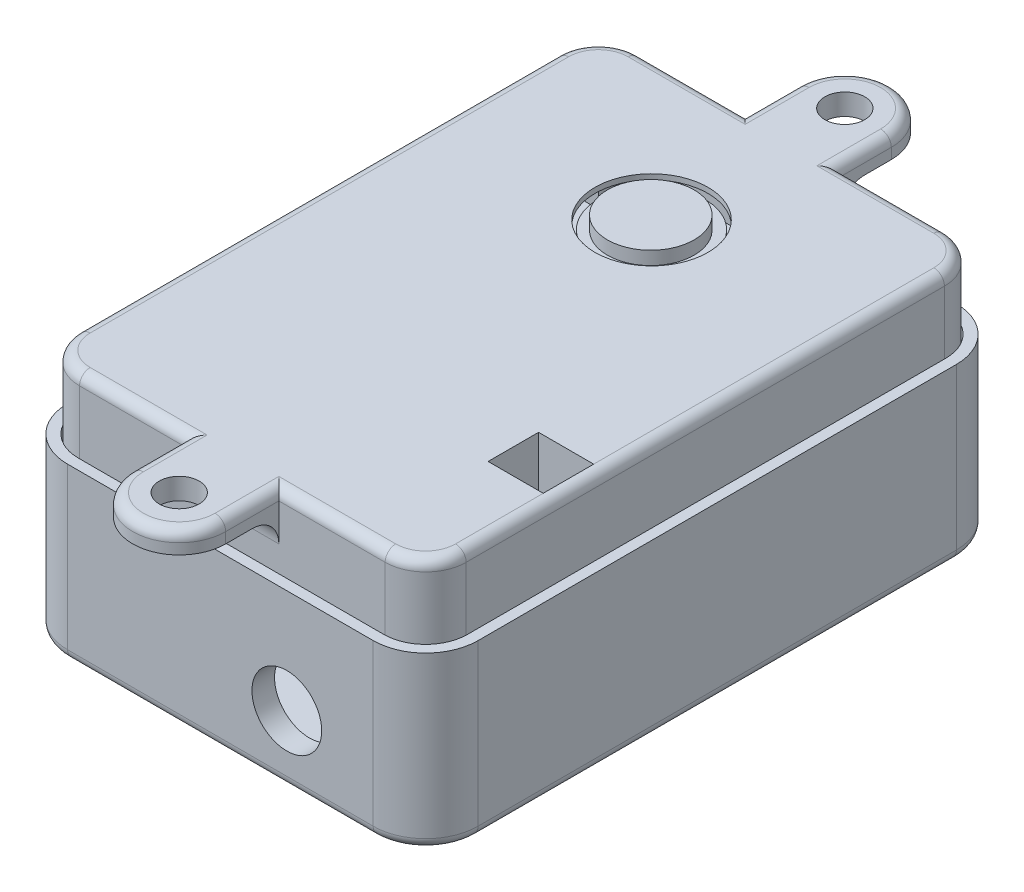
from build123d import *

# Parameters (mm, degrees)
BOSS_EXTRUDE1_DEPTH     = 1
SKETCH2_W               = 15
SKETCH2_H               = 15
BOSS_EXTRUDE2_DEPTH     = 2
SKETCH3_R               = 4
BOSS_EXTRUDE3_DEPTH     = 6.25
SKETCH5_W               = 3
SKETCH5_H               = 3
BOSS_EXTRUDE4_DEPTH     = 1
BOSS_EXTRUDE5_START     = 0.25
SKETCH6_R               = 4.25
BOSS_EXTRUDE5_DEPTH     = 0.4
BOSS_EXTRUDE7_DEPTH     = 9.5
BOSS_EXTRUDE9_DEPTH     = 8.4
SKETCH11_W              = 4.15
SKETCH11_H              = 3.8
CUT_EXTRUDE1_DEPTH      = 0.4
SKETCH12_W              = 18.75
SKETCH12_H              = 25.65
BOSS_EXTRUDE10_DEPTH    = 0.75
BOSS_EXTRUDE11_DEPTH    = 2.3
SKETCH14_W              = 2.5
SKETCH14_H              = 20.2
BOSS_EXTRUDE12_DEPTH    = 2.45
SKETCH16_W              = 0.6
SKETCH16_H              = 0.6
BOSS_EXTRUDE14_DEPTH    = 5.5
LPATTERN1_COUNT         = 8
LPATTERN1_PITCH         = 2.5
BOSS_EXTRUDE15_START    = 5
BOSS_EXTRUDE15_DEPTH    = 12.5
BOSS_EXTRUDE16_DEPTH    = 7.95
SKETCH19_W              = 3.5
SKETCH19_H              = 21.2
BOSS_EXTRUDE17_DEPTH    = 0.4
SKETCH20_R              = 2.625
CUT_EXTRUDE2_DEPTH      = 1.7
BOSS_EXTRUDE18_DEPTH    = 7.95
BOSS_EXTRUDE19_DEPTH    = 7.4
MIRROR1_COPY_1_SKETCH_W = 0.6
MIRROR1_COPY_1_SKETCH_H = 0.6
MIRROR1_COPY_1_DEPTH    = 5.5
MIRROR1_COPY_2_SKETCH_W = 0.6
MIRROR1_COPY_2_SKETCH_H = 0.6
MIRROR1_COPY_2_DEPTH    = 5.5
MIRROR1_COPY_3_SKETCH_W = 0.6
MIRROR1_COPY_3_SKETCH_H = 0.6
MIRROR1_COPY_3_DEPTH    = 5.5
MIRROR1_COPY_4_SKETCH_W = 0.6
MIRROR1_COPY_4_SKETCH_H = 0.6
MIRROR1_COPY_4_DEPTH    = 5.5
MIRROR1_COPY_5_SKETCH_W = 0.6
MIRROR1_COPY_5_SKETCH_H = 0.6
MIRROR1_COPY_5_DEPTH    = 5.5
MIRROR1_COPY_6_SKETCH_W = 0.6
MIRROR1_COPY_6_SKETCH_H = 0.6
MIRROR1_COPY_6_DEPTH    = 5.5
MIRROR1_COPY_7_SKETCH_W = 0.6
MIRROR1_COPY_7_SKETCH_H = 0.6
MIRROR1_COPY_7_DEPTH    = 5.5
SKETCH24_R              = 1.5
BOSS_EXTRUDE20_DEPTH    = 1.6
FILLET1_R               = 2
FILLET2_R               = 0.8
FILLET3_R               = 0.8
SKETCH25_R              = 3.262617174
BOSS_EXTRUDE21_DEPTH    = 1


with BuildPart() as part:
    # Sketch1 → Boss-Extrude1 (new body)
    with BuildSketch(Plane(origin=(0, 0, 0), x_dir=(1, 0, 0), z_dir=(0, 1, 0))):
        with BuildLine():
            Line((-11.5, 20), (11.5, 20))
            ThreePointArc((11.5, 20), (12.914213562, 19.414213562), (13.5, 18))
            Line((13.5, 18), (13.5, -18))
            ThreePointArc((13.5, -18), (12.914213562, -19.414213562), (11.5, -20))
            Line((11.5, -20), (-11.5, -20))
            ThreePointArc((-11.5, -20), (-12.914213562, -19.414213562), (-13.5, -18))
            Line((-13.5, -18), (-13.5, 18))
            ThreePointArc((-13.5, 18), (-12.914213562, 19.414213562), (-11.5, 20))
        make_face()
    extrude(amount=BOSS_EXTRUDE1_DEPTH)

    # Sketch2 → Boss-Extrude2 (add)
    with BuildSketch(Plane(origin=(0, 1, 0), x_dir=(1, 0, 0), z_dir=(0, 1, 0))):
        with Locations((0, 12.5)):
            Rectangle(SKETCH2_W, SKETCH2_H)
    extrude(amount=BOSS_EXTRUDE2_DEPTH)

    # Sketch3 → Boss-Extrude3 (add)
    with BuildSketch(Plane(origin=(0, 3, 0), x_dir=(1, 0, 0), z_dir=(0, 1, 0))):
        with Locations(Location((0, 10.5, 0), (0, 0, 270))):
            Circle(SKETCH3_R)
    extrude(amount=BOSS_EXTRUDE3_DEPTH)

    # Sketch5 → Boss-Extrude4 (add)
    with BuildSketch(Plane(origin=(0, 1, 0), x_dir=(1, 0, 0), z_dir=(0, 1, 0))):
        with Locations((11.5, -9.5)):
            Rectangle(SKETCH5_W, SKETCH5_H)
    extrude(amount=BOSS_EXTRUDE4_DEPTH)

    # Sketch12 → Boss-Extrude10 (add)
    with BuildSketch(Plane.XZ):
        with Locations((0, 7.175)):
            Rectangle(SKETCH12_W, SKETCH12_H)
    extrude(amount=BOSS_EXTRUDE10_DEPTH)

    # Sketch13 → Boss-Extrude11 (add)
    with BuildSketch(Plane.XZ.offset(0.75)):
        Polygon((2, 12.35), (-8, 12.35), (-8, -5.15), (8, -5.15), (8, 9.35), (2, 9.35), align=None)
    extrude(amount=BOSS_EXTRUDE11_DEPTH)

    # Sketch14 → Boss-Extrude12 (add)
    with BuildSketch(Plane.XZ):
        with Locations((11.5, -6.1)):
            Rectangle(SKETCH14_W, SKETCH14_H)
    boss_extrude12 = extrude(amount=BOSS_EXTRUDE12_DEPTH)

    # Sketch16 → Boss-Extrude14 (add)
    with BuildSketch(Plane.XZ.offset(2.45)):
        with Locations((11.5, 2.7)):
            Rectangle(SKETCH16_W, SKETCH16_H)
    boss_extrude14 = extrude(amount=BOSS_EXTRUDE14_DEPTH)

    # LPattern1: Boss-Extrude14 ×8
    with Locations(*[(0, 0, -i * LPATTERN1_PITCH) for i in range(1, LPATTERN1_COUNT)]):
        add(boss_extrude14)

    # Mirror1: Boss-Extrude12, Boss-Extrude14 across plane
    add(boss_extrude12.mirror(Plane(origin=(0, 0, 0), x_dir=(0, 0, 1), z_dir=(1, 0, 0))))
    add(boss_extrude14.mirror(Plane(origin=(0, 0, 0), x_dir=(0, 0, 1), z_dir=(1, 0, 0))))

    # Mirror1 copy 1 sketch → Mirror1 copy 1 (add)
    with BuildSketch(Plane(origin=(0, -2.45, -2.5), x_dir=(-1, 0, 0), z_dir=(0, -1, 0))):
        with Locations((11.5, -2.7)):
            Rectangle(MIRROR1_COPY_1_SKETCH_W, MIRROR1_COPY_1_SKETCH_H)
    extrude(amount=MIRROR1_COPY_1_DEPTH)

    # Mirror1 copy 2 sketch → Mirror1 copy 2 (add)
    with BuildSketch(Plane(origin=(0, -2.45, -5), x_dir=(-1, 0, 0), z_dir=(0, -1, 0))):
        with Locations((11.5, -2.7)):
            Rectangle(MIRROR1_COPY_2_SKETCH_W, MIRROR1_COPY_2_SKETCH_H)
    extrude(amount=MIRROR1_COPY_2_DEPTH)

    # Mirror1 copy 3 sketch → Mirror1 copy 3 (add)
    with BuildSketch(Plane(origin=(0, -2.45, -7.5), x_dir=(-1, 0, 0), z_dir=(0, -1, 0))):
        with Locations((11.5, -2.7)):
            Rectangle(MIRROR1_COPY_3_SKETCH_W, MIRROR1_COPY_3_SKETCH_H)
    extrude(amount=MIRROR1_COPY_3_DEPTH)

    # Mirror1 copy 4 sketch → Mirror1 copy 4 (add)
    with BuildSketch(Plane(origin=(0, -2.45, -10), x_dir=(-1, 0, 0), z_dir=(0, -1, 0))):
        with Locations((11.5, -2.7)):
            Rectangle(MIRROR1_COPY_4_SKETCH_W, MIRROR1_COPY_4_SKETCH_H)
    extrude(amount=MIRROR1_COPY_4_DEPTH)

    # Mirror1 copy 5 sketch → Mirror1 copy 5 (add)
    with BuildSketch(Plane(origin=(0, -2.45, -12.5), x_dir=(-1, 0, 0), z_dir=(0, -1, 0))):
        with Locations((11.5, -2.7)):
            Rectangle(MIRROR1_COPY_5_SKETCH_W, MIRROR1_COPY_5_SKETCH_H)
    extrude(amount=MIRROR1_COPY_5_DEPTH)

    # Mirror1 copy 6 sketch → Mirror1 copy 6 (add)
    with BuildSketch(Plane(origin=(0, -2.45, -15), x_dir=(-1, 0, 0), z_dir=(0, -1, 0))):
        with Locations((11.5, -2.7)):
            Rectangle(MIRROR1_COPY_6_SKETCH_W, MIRROR1_COPY_6_SKETCH_H)
    extrude(amount=MIRROR1_COPY_6_DEPTH)

    # Mirror1 copy 7 sketch → Mirror1 copy 7 (add)
    with BuildSketch(Plane(origin=(0, -2.45, -17.5), x_dir=(-1, 0, 0), z_dir=(0, -1, 0))):
        with Locations((11.5, -2.7)):
            Rectangle(MIRROR1_COPY_7_SKETCH_W, MIRROR1_COPY_7_SKETCH_H)
    extrude(amount=MIRROR1_COPY_7_DEPTH)

    # Sketch25 → Boss-Extrude21 (add)
    with BuildSketch(Plane(origin=(0, 9.25, 0), x_dir=(1, 0, 0), z_dir=(0, 1, 0))):
        with Locations(Location((0, 10.445391235, 0), (0, 0, 270))):
            Circle(SKETCH25_R)
    extrude(amount=BOSS_EXTRUDE21_DEPTH)


with BuildPart() as body_2:
    # Sketch6 → Boss-Extrude5 (new body)
    with BuildSketch(Plane(origin=(0, 9.25, 0), x_dir=(1, 0, 0), z_dir=(0, 1, 0)).offset(BOSS_EXTRUDE5_START)):
        with BuildLine():
            Line((7.5, 21.05), (-7.5, 21.05))
            Line((-7.5, 21.05), (-11.5, 21.05))
            ThreePointArc((-11.5, 21.05), (-13.656675683, 20.156675683), (-14.55, 18))
            Line((-14.55, 18), (-14.55, -18))
            ThreePointArc((-14.55, -18), (-13.656675683, -20.156675683), (-11.5, -21.05))
            Line((-11.5, -21.05), (11.5, -21.05))
            ThreePointArc((11.5, -21.05), (13.656675683, -20.156675683), (14.55, -18))
            Line((14.55, -18), (14.55, 18))
            ThreePointArc((14.55, 18), (13.656675683, 20.156675683), (11.5, 21.05))
            Line((11.5, 21.05), (7.5, 21.05))
        make_face()
        with Locations(Location((0, 10.5, 0), (0, 0, 270))):
            Circle(SKETCH6_R, mode=Mode.SUBTRACT)
    extrude(amount=BOSS_EXTRUDE5_DEPTH)

    # Sketch8 → Boss-Extrude7 (add)
    with BuildSketch(Plane.XZ.offset(-9.5)):
        with BuildLine():
            Line((-11.5, -21.05), (11.5, -21.05))
            ThreePointArc((11.5, -21.05), (13.656675683, -20.156675683), (14.55, -18))
            Line((14.55, -18), (14.55, 18))
            ThreePointArc((14.55, 18), (13.656675683, 20.156675683), (11.5, 21.05))
            Line((11.5, 21.05), (-11.5, 21.05))
            ThreePointArc((-11.5, 21.05), (-13.656675683, 20.156675683), (-14.55, 18))
            Line((-14.55, 18), (-14.55, -18))
            ThreePointArc((-14.55, -18), (-13.656675683, -20.156675683), (-11.5, -21.05))
        make_face()
        with BuildLine():
            Line((-11.5, -20.25), (11.5, -20.25))
            ThreePointArc((11.5, -20.25), (13.090990258, -19.590990258), (13.75, -18))
            Line((13.75, -18), (13.75, 18))
            ThreePointArc((13.75, 18), (13.090990258, 19.590990258), (11.5, 20.25))
            Line((11.5, 20.25), (-11.5, 20.25))
            ThreePointArc((-11.5, 20.25), (-13.090990258, 19.590990258), (-13.75, 18))
            Line((-13.75, 18), (-13.75, -18))
            ThreePointArc((-13.75, -18), (-13.090990258, -19.590990258), (-11.5, -20.25))
        make_face(mode=Mode.SUBTRACT)
    extrude(amount=BOSS_EXTRUDE7_DEPTH)

    # Sketch9 → Boss-Extrude9 (add)
    with BuildSketch(Plane.XZ.offset(-9.5)):
        with BuildLine():
            Line((13.75, 18), (11.5, 18))
            Line((11.5, 18), (11.5, 20.25))
            ThreePointArc((11.5, 20.25), (13.090990258, 19.590990258), (13.75, 18))
        make_face()
        with BuildLine():
            Line((11.5, -18), (11.5, -20.25))
            ThreePointArc((11.5, -20.25), (13.090990258, -19.590990258), (13.75, -18))
            Line((13.75, -18), (11.5, -18))
        make_face()
        with BuildLine():
            Line((-13.75, -18), (-11.5, -18))
            Line((-11.5, -18), (-11.5, -20.25))
            ThreePointArc((-11.5, -20.25), (-13.090990258, -19.590990258), (-13.75, -18))
        make_face()
        with BuildLine():
            Line((-11.5, 18), (-11.5, 20.25))
            ThreePointArc((-11.5, 20.25), (-13.090990258, 19.590990258), (-13.75, 18))
            Line((-13.75, 18), (-11.5, 18))
        make_face()
    extrude(amount=BOSS_EXTRUDE9_DEPTH)

    # Sketch11 → Cut-Extrude1 (cut)
    with BuildSketch(Plane(origin=(0, 9.9, 0), x_dir=(1, 0, 0), z_dir=(0, 1, 0))):
        with Locations((11.675, -9.5)):
            Rectangle(SKETCH11_W, SKETCH11_H)
    extrude(amount=-CUT_EXTRUDE1_DEPTH, mode=Mode.SUBTRACT)

    # Sketch23 → Boss-Extrude19 (add)
    with BuildSketch(Plane.XZ.offset(-9.5)):
        Polygon((9.6, 11.4), (13.75, 11.4), (13.75, 12.2), (8.8, 12.2), (8.8, 6.8), (13.75, 6.8), (13.75, 7.6), (9.6, 7.6), align=None)
    extrude(amount=BOSS_EXTRUDE19_DEPTH)

    # Sketch24 → Boss-Extrude20 (add)
    # profile 1 of 2: a face of its own
    with BuildSketch(Plane(origin=(0, 9.9, 0), x_dir=(1, 0, 0), z_dir=(0, 1, 0))):
        with BuildLine():
            Line((-3.5, 25.05), (-3.5, 21.05))
            Line((-3.5, 21.05), (3.5, 21.05))
            Line((3.5, 21.05), (3.5, 25.05))
            ThreePointArc((3.5, 25.05), (0, 28.55), (-3.5, 25.05))
        make_face()
        with Locations(Location((0, 25.05, 0), (0, 0, 270))):
            Circle(SKETCH24_R, mode=Mode.SUBTRACT)
    # profile 2 of 2: a face of its own
    with BuildSketch(Plane(origin=(0, 9.9, 0), x_dir=(1, 0, 0), z_dir=(0, 1, 0))):
        with BuildLine():
            Line((-3.5, -21.05), (3.5, -21.05))
            Line((3.5, -21.05), (3.5, -25.05))
            ThreePointArc((3.5, -25.05), (0, -28.55), (-3.5, -25.05))
            Line((-3.5, -25.05), (-3.5, -21.05))
        make_face()
        with Locations(Location((0, -25.05, 0), (0, 0, 90))):
            Circle(SKETCH24_R, mode=Mode.SUBTRACT)
    extrude(amount=-BOSS_EXTRUDE20_DEPTH)

    # Fillet1
    fillet1_edges = [body_2.edges().sort_by_distance(p)[0] for p in [
        (0, 8.3, -21.05),
        (0, 8.3, 21.05),
    ]]
    fillet(fillet1_edges, radius=FILLET1_R)

    # Fillet3
    fillet3_edges = [body_2.edges().sort_by_distance(p)[0] for p in [
        (-7.5, 9.9, -21.05),
        (0, 9.9, -28.55),
        (-3.5, 9.9, -23.05),
        (3.5, 9.9, -23.05),
        (-13.656675683, 9.9, -20.156675683),
        (7.5, 9.9, 21.05),
        (0, 9.9, 28.55),
        (3.5, 9.9, 23.05),
        (-3.5, 9.9, 23.05),
        (-14.55, 9.9, 0),
        (-13.656675683, 9.9, 20.156675683),
        (-7.5, 9.9, 21.05),
        (13.656675683, 9.9, 20.156675683),
        (14.55, 9.9, 0),
        (13.656675683, 9.9, -20.156675683),
        (7.5, 9.9, -21.05),
    ]]
    fillet(fillet3_edges, radius=FILLET3_R - 0.0001)  # a hair under: the kernel refuses the full size


with BuildPart() as body_3:
    # Sketch17 → Boss-Extrude15 (new body)
    with BuildSketch(Plane.XZ.offset(3.05).offset(BOSS_EXTRUDE15_START)):
        with BuildLine():
            Line((-11.5, -21.95), (11.5, -21.95))
            ThreePointArc((11.5, -21.95), (14.293071786, -20.793071786), (15.45, -18))
            Line((15.45, -18), (15.45, 18))
            ThreePointArc((15.45, 18), (14.293071786, 20.793071786), (11.5, 21.95))
            Line((11.5, 21.95), (-11.5, 21.95))
            ThreePointArc((-11.5, 21.95), (-14.293071786, 20.793071786), (-15.45, 18))
            Line((-15.45, 18), (-15.45, -18))
            ThreePointArc((-15.45, -18), (-14.293071786, -20.793071786), (-11.5, -21.95))
        make_face()
        with BuildLine():
            Line((-11.5, -21.15), (11.5, -21.15))
            ThreePointArc((11.5, -21.15), (13.727386361, -20.227386361), (14.65, -18))
            Line((14.65, -18), (14.65, 18))
            ThreePointArc((14.65, 18), (13.727386361, 20.227386361), (11.5, 21.15))
            Line((11.5, 21.15), (-11.5, 21.15))
            ThreePointArc((-11.5, 21.15), (-13.727386361, 20.227386361), (-14.65, 18))
            Line((-14.65, 18), (-14.65, -18))
            ThreePointArc((-14.65, -18), (-13.727386361, -20.227386361), (-11.5, -21.15))
        make_face(mode=Mode.SUBTRACT)
    extrude(amount=-BOSS_EXTRUDE15_DEPTH)

    # Sketch18 → Boss-Extrude16 (add)
    with BuildSketch(Plane.XZ.offset(8.05)):
        with BuildLine():
            Line((-11.5, -21.15), (11.5, -21.15))
            ThreePointArc((11.5, -21.15), (13.727386361, -20.227386361), (14.65, -18))
            Line((14.65, -18), (14.65, 18))
            ThreePointArc((14.65, 18), (13.727386361, 20.227386361), (11.5, 21.15))
            Line((11.5, 21.15), (-11.5, 21.15))
            ThreePointArc((-11.5, 21.15), (-13.727386361, 20.227386361), (-14.65, 18))
            Line((-14.65, 18), (-14.65, -18))
            ThreePointArc((-14.65, -18), (-13.727386361, -20.227386361), (-11.5, -21.15))
        make_face()
        with BuildLine():
            Line((-11.5, -20.25), (11.5, -20.25))
            ThreePointArc((11.5, -20.25), (13.090990258, -19.590990258), (13.75, -18))
            Line((13.75, -18), (13.75, 18))
            ThreePointArc((13.75, 18), (13.090990258, 19.590990258), (11.5, 20.25))
            Line((11.5, 20.25), (-11.5, 20.25))
            ThreePointArc((-11.5, 20.25), (-13.090990258, 19.590990258), (-13.75, 18))
            Line((-13.75, 18), (-13.75, -18))
            ThreePointArc((-13.75, -18), (-13.090990258, -19.590990258), (-11.5, -20.25))
        make_face(mode=Mode.SUBTRACT)
    extrude(amount=-BOSS_EXTRUDE16_DEPTH)

    # Sketch19 → Boss-Extrude17 (add)
    with BuildSketch(Plane.XZ.offset(8.05)):
        with BuildLine():
            Line((11.5, 21.95), (-11.5, 21.95))
            ThreePointArc((-11.5, 21.95), (-14.293071786, 20.793071786), (-15.45, 18))
            Line((-15.45, 18), (-15.45, -18))
            ThreePointArc((-15.45, -18), (-14.293071786, -20.793071786), (-11.5, -21.95))
            Line((-11.5, -21.95), (11.5, -21.95))
            ThreePointArc((11.5, -21.95), (14.293071786, -20.793071786), (15.45, -18))
            Line((15.45, -18), (15.45, 18))
            ThreePointArc((15.45, 18), (14.293071786, 20.793071786), (11.5, 21.95))
        make_face()
        with Locations((-11.5, -6.1)):
            Rectangle(SKETCH19_W, SKETCH19_H, mode=Mode.SUBTRACT)
        with Locations((11.5, -6.1)):
            Rectangle(SKETCH19_W, SKETCH19_H, mode=Mode.SUBTRACT)
    extrude(amount=BOSS_EXTRUDE17_DEPTH)

    # Sketch20 → Cut-Extrude2 (cut)
    with BuildSketch(Plane.XY.offset(21.95)):
        with Locations((5, -3.375)):
            Circle(SKETCH20_R)
    extrude(amount=-CUT_EXTRUDE2_DEPTH, mode=Mode.SUBTRACT)

    # Sketch22 → Boss-Extrude18 (add)
    with BuildSketch(Plane(origin=(0, -8.05, 0), x_dir=(1, 0, 0), z_dir=(0, 1, 0))):
        with BuildLine():
            Line((13.75, -18), (11.5, -18))
            Line((11.5, -18), (11.5, -20.25))
            ThreePointArc((11.5, -20.25), (13.090990258, -19.590990258), (13.75, -18))
        make_face()
        with BuildLine():
            Line((11.5, 18), (11.5, 20.25))
            ThreePointArc((11.5, 20.25), (13.090990258, 19.590990258), (13.75, 18))
            Line((13.75, 18), (11.5, 18))
        make_face()
        with BuildLine():
            Line((-13.75, 18), (-11.5, 18))
            Line((-11.5, 18), (-11.5, 20.25))
            ThreePointArc((-11.5, 20.25), (-13.090990258, 19.590990258), (-13.75, 18))
        make_face()
        with BuildLine():
            Line((-11.5, -18), (-11.5, -20.25))
            ThreePointArc((-11.5, -20.25), (-13.090990258, -19.590990258), (-13.75, -18))
            Line((-13.75, -18), (-11.5, -18))
        make_face()
    extrude(amount=BOSS_EXTRUDE18_DEPTH)

    # Fillet2
    fillet2_edges = [body_3.edges().sort_by_distance(p)[0] for p in [
        (14.293071786, -8.45, 20.793071786),
        (0, -8.45, 21.95),
        (-14.293071786, -8.45, 20.793071786),
        (-15.45, -8.45, 0),
        (-14.293071786, -8.45, -20.793071786),
        (0, -8.45, -21.95),
        (14.293071786, -8.45, -20.793071786),
        (15.45, -8.45, 0),
    ]]
    fillet(fillet2_edges, radius=FILLET2_R)


solid = Compound([part.part, body_2.part, body_3.part])
